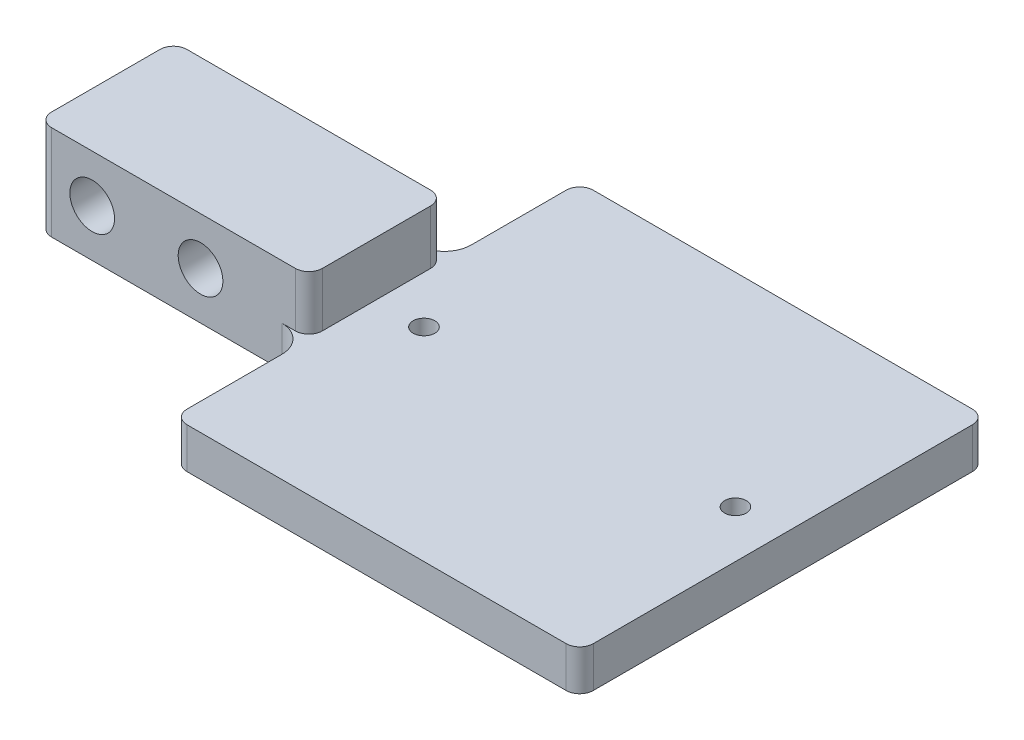
from build123d import *

# Parameters (mm, degrees)
SKETCH1_W             = 30
SKETCH1_H             = 15
BOSS_EXTRUDE1_DEPTH   = 3
SKETCH2_W             = 5
SKETCH2_H             = 7
BOSS_EXTRUDE2_DEPTH   = 20
CUT_EXTRUDE1_DEPTH    = 18
FILLET2_R             = 2
FILLET3_R             = 1
M2X0_4_TAPPED_HOLE1_D = 1.6
M4X0_7_TAPPED_HOLE1_D = 3.3


with BuildPart() as part:
    # Sketch1 → Boss-Extrude1 (new body)
    with BuildSketch(Plane(origin=(0, 0, 0), x_dir=(1, 0, 0), z_dir=(0, 1, 0))):
        with Locations((15, 7.5)):
            Rectangle(SKETCH1_W, SKETCH1_H)
    extrude(amount=BOSS_EXTRUDE1_DEPTH)

    # Sketch2 → Boss-Extrude2 (add)
    with BuildSketch(Plane.ZY):
        with Locations((-12.5, 3.5)):
            Rectangle(SKETCH2_W, SKETCH2_H)
    extrude(amount=BOSS_EXTRUDE2_DEPTH)

    # Sketch3 → Cut-Extrude1 (cut)
    with BuildSketch(Plane.ZY.offset(20)):
        with BuildLine():
            Line((-15, 1), (-15, 6))
            ThreePointArc((-15, 6), (-12.5, 3.5), (-15, 1))
        make_face()
    extrude(amount=-CUT_EXTRUDE1_DEPTH, mode=Mode.SUBTRACT)

    # Mirror1: part across plane


with BuildPart() as part_1:
    add(part.part)
    add(part.part.mirror(Plane(origin=(0, 3, -15), x_dir=(1, 0, 0), z_dir=(0, 0, 1))))

    # Fillet2
    fillet2_edges = [part_1.edges().sort_by_distance(p)[0] for p in [
        (0, 1.5, -10),
        (0, 1.5, -20),
    ]]
    fillet(fillet2_edges, radius=FILLET2_R)

    # Fillet3
    fillet3_edges = [part_1.edges().sort_by_distance(p)[0] for p in [
        (30, 1.5, 0),
        (0, 1.5, 0),
        (0, 1.5, -30),
        (30, 1.5, -30),
        (0, 5, -20),
        (0, 5, -10),
        (-20, 3.5, -10),
        (-20, 3.5, -20),
    ]]
    fillet(fillet3_edges, radius=FILLET3_R)

    # M2x0.4 Tapped Hole1 (through all)
    with Locations(Plane(origin=(3.5, 3, -15), x_dir=(0, 0, 1), z_dir=(0, 1, 0))):
        with Locations((0, 0), (0, 23)):
            Hole(M2X0_4_TAPPED_HOLE1_D / 2)

    # M4x0.7 Tapped Hole1 (through all)
    with Locations(Plane(origin=(-16, 3.5, -10), x_dir=(1, 0, 0), z_dir=(0, 0, 1))):
        with Locations((0, 0), (8, 0)):
            Hole(M4X0_7_TAPPED_HOLE1_D / 2)


solid = part_1.part
